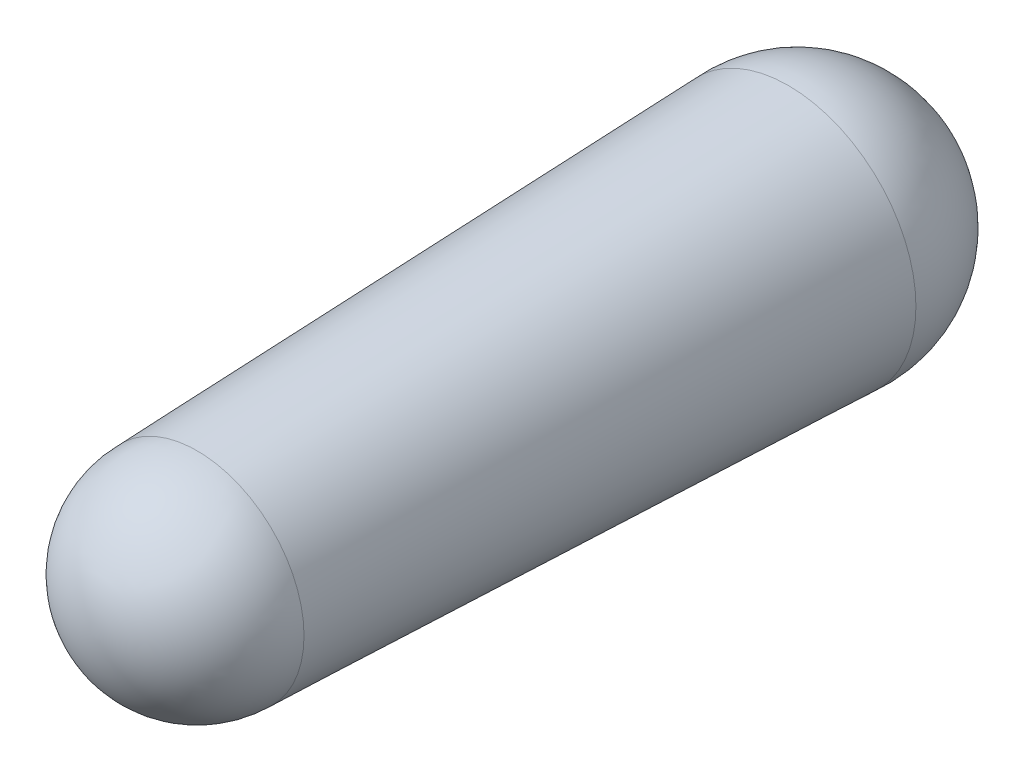
from build123d import *

# Parameters (mm, degrees)
SKETCH2_R           = 2.13
BOSS_EXTRUDE1_DEPTH = 10
BOSS_EXTRUDE1_TAPER = 2


with BuildPart() as part:
    # Sketch1 → Revolve1 (revolve)
    with BuildSketch(Plane.XY):
        with BuildLine():
            Line((0, 2.13), (0, -2.13))
            ThreePointArc((0, -2.13), (2.13, 0), (0, 2.13))
        make_face()
    revolve(axis=Axis((0, 2.13, 0), (0, -1, 0)))

    # Sketch2 → Boss-Extrude1 (add)
    with BuildSketch(Plane.XY):
        Circle(SKETCH2_R)
    extrude(amount=BOSS_EXTRUDE1_DEPTH, taper=BOSS_EXTRUDE1_TAPER)

    # Sketch3 → Revolve2 (revolve)
    with BuildSketch(Plane.XY.offset(10)):
        with BuildLine():
            Line((0, 1.780792305), (0, -1.780792305))
            ThreePointArc((0, -1.780792305), (1.780792305, 0), (0, 1.780792305))
        make_face()
    revolve(axis=Axis((0, 1.780792305, 10), (0, -1, 0)))


solid = part.part
